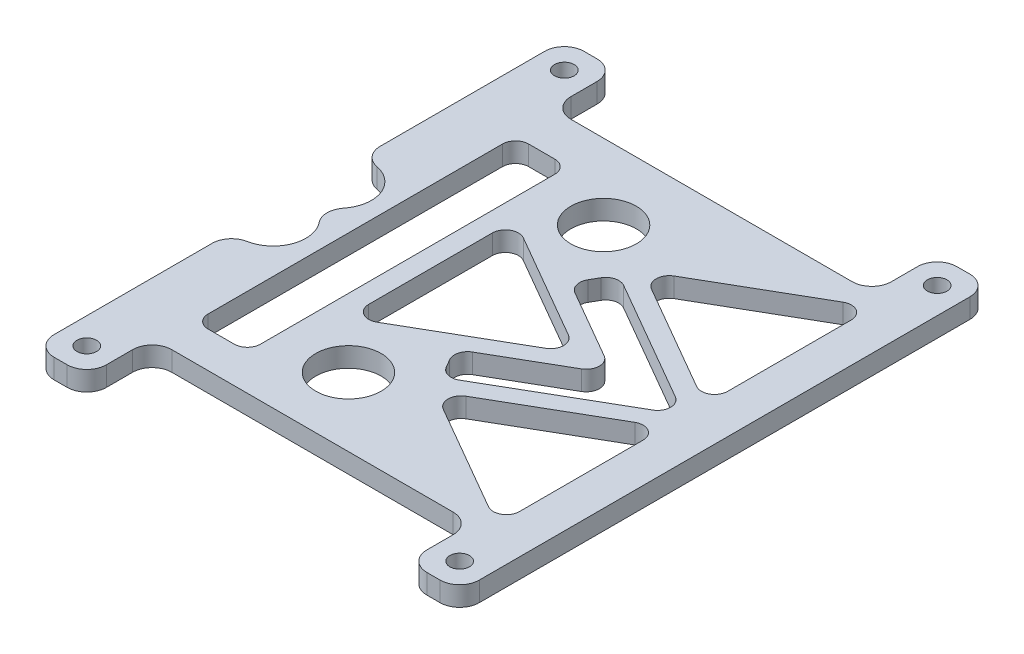
from build123d import *

# Parameters (mm, degrees)
SKETCH1_R           = 5
SKETCH1_R_2         = 1.5
BOSS_EXTRUDE1_DEPTH = 3
FILLET1_R           = 3
SKETCH2_W           = 8
SKETCH2_H           = 49
CUT_EXTRUDE1_DEPTH  = 104.979147454
FILLET2_R           = 2


with BuildPart() as part:
    # Sketch1 → Boss-Extrude1 (new body)
    with BuildSketch(Plane(origin=(0, 0, 0), x_dir=(1, 0, 0), z_dir=(0, 1, 0))):
        with BuildLine():
            Line((10.905619524, 39.769696007), (10.905619524, 61))
            Line((10.905619524, 61), (10.905619524, 71))
            Line((10.905619524, 71), (18.905619524, 71))
            Line((18.905619524, 71), (18.905619524, 61))
            Line((18.905619524, 61), (67.905619524, 61))
            Line((67.905619524, 61), (67.905619524, 71))
            Line((67.905619524, 71), (75.905619524, 71))
            Line((75.905619524, 71), (75.905619524, 61))
            Line((75.905619524, 61), (75.905619524, 0))
            Line((75.905619524, 0), (75.905619524, -10))
            Line((75.905619524, -10), (67.905619524, -10))
            Line((67.905619524, -10), (67.905619524, 0))
            Line((67.905619524, 0), (18.905619524, 0))
            Line((18.905619524, 0), (18.905619524, -10))
            Line((18.905619524, -10), (10.905619524, -10))
            Line((10.905619524, -10), (10.905619524, 0))
            Line((10.905619524, 0), (10.905619524, 20.230303993))
            ThreePointArc((10.905619524, 20.230303993), (17.347708153, 24.241211504), (12.405619524, 30))
            ThreePointArc((12.405619524, 30), (17.347708153, 35.758788496), (10.905619524, 39.769696007))
        make_face()
        with Locations((38.405619524, 10.5)):
            Circle(SKETCH1_R, mode=Mode.SUBTRACT)
        with Locations((38.405619524, 49.5)):
            Circle(SKETCH1_R, mode=Mode.SUBTRACT)
        with Locations((14.905619524, -6)):
            Circle(SKETCH1_R_2, mode=Mode.SUBTRACT)
        with Locations((14.905619524, 67)):
            Circle(SKETCH1_R_2, mode=Mode.SUBTRACT)
        with Locations((71.905619524, -6)):
            Circle(SKETCH1_R_2, mode=Mode.SUBTRACT)
        with Locations((71.905619524, 67)):
            Circle(SKETCH1_R_2, mode=Mode.SUBTRACT)
    extrude(amount=BOSS_EXTRUDE1_DEPTH)

    # Fillet1
    fillet1_edges = [part.edges().sort_by_distance(p)[0] for p in [
        (75.905619524, 1.5, 10),
        (67.905619524, 1.5, 10),
        (67.905619524, 1.5, 0),
        (18.905619524, 1.5, 0),
        (18.905619524, 1.5, 10),
        (10.905619524, 1.5, 10),
        (10.905619524, 1.5, -20.230303993),
        (12.405619524, 1.5, -30),
        (10.905619524, 1.5, -39.769696007),
        (10.905619524, 1.5, -71),
        (18.905619524, 1.5, -71),
        (18.905619524, 1.5, -61),
        (67.905619524, 1.5, -61),
        (67.905619524, 1.5, -71),
        (75.905619524, 1.5, -71),
    ]]
    fillet(fillet1_edges, radius=FILLET1_R)

    # Sketch2 → Cut-Extrude1 (cut, through all)
    with BuildSketch(Plane(origin=(0, 3, 0), x_dir=(1, 0, 0), z_dir=(0, 1, 0))):
        Polygon((53.314584868, 30.5), (30.951136852, 43.411542732), (30.951136852, 17.588457268), align=None)
        Polygon((69.905619524, 27.5), (69.905619524, 1.676914536), (47.542171508, 14.588457268), align=None)
        Polygon((47.542171508, 46.411542732), (69.905619524, 33.5), (69.905619524, 59.323085464), align=None)
        Polygon((69.654975177, 30.5), (46.180472316, 44.053010546), (43.457073931, 39.335946174), (58.761381637, 30.5), (43.457073931, 21.664053826), (46.180472316, 16.946989454), align=None)
        with Locations((23.951136852, 30)):
            Rectangle(SKETCH2_W, SKETCH2_H)
    extrude(amount=-CUT_EXTRUDE1_DEPTH, mode=Mode.SUBTRACT)

    # Fillet2
    fillet2_edges = [part.edges().sort_by_distance(p)[0] for p in [
        (69.905619524, 1.5, -1.676914536),
        (47.542171508, 1.5, -14.588457268),
        (69.905619524, 1.5, -27.5),
        (69.905619524, 1.5, -59.323085464),
        (69.905619524, 1.5, -33.5),
        (47.542171508, 1.5, -46.411542732),
        (69.654975177, 1.5, -30.5),
        (46.180472316, 1.5, -44.053010546),
        (43.457073931, 1.5, -39.335946174),
        (58.761381637, 1.5, -30.5),
        (43.457073931, 1.5, -21.664053826),
        (46.180472316, 1.5, -16.946989454),
        (30.951136852, 1.5, -17.588457268),
        (53.314584868, 1.5, -30.5),
        (30.951136852, 1.5, -43.411542732),
        (19.951136852, 1.5, -5.5),
        (27.951136852, 1.5, -5.5),
        (27.951136852, 1.5, -54.5),
        (19.951136852, 1.5, -54.5),
    ]]
    fillet(fillet2_edges, radius=FILLET2_R)


solid = part.part
